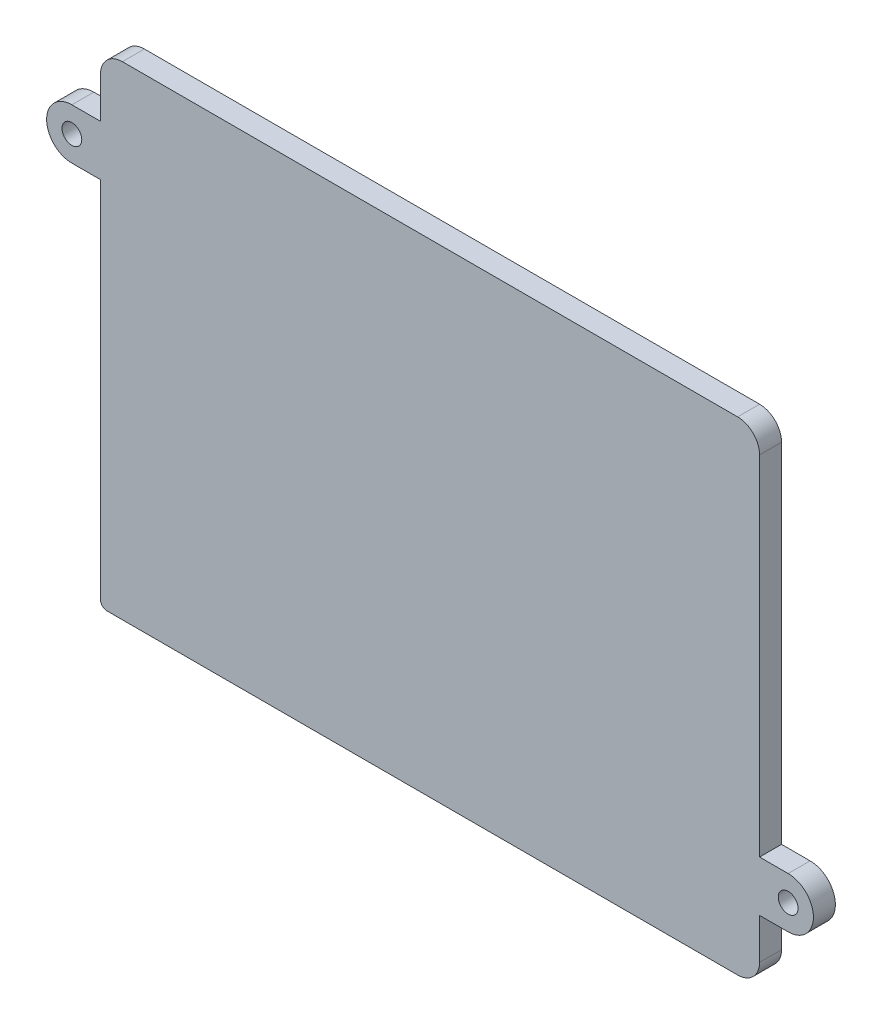
from build123d import *

# Parameters (mm, degrees)
SKETCH1_R           = 2.25
BOSS_EXTRUDE1_DEPTH = 5
BOSS_EXTRUDE2_DEPTH = 2


with BuildPart() as part:
    # Sketch1 → Boss-Extrude1 (new body)
    with BuildSketch(Plane.XY):
        with BuildLine():
            ThreePointArc((75, 50), (73.535533906, 53.535533906), (70, 55))
            Line((70, 55), (-70, 55))
            ThreePointArc((-70, 55), (-73.535533906, 53.535533906), (-75, 50))
            Line((-75, 50), (-75, 40.75))
            Line((-75, 40.75), (-81.5, 40.75))
            ThreePointArc((-81.5, 40.75), (-87.25, 35), (-81.5, 29.25))
            Line((-81.5, 29.25), (-75, 29.25))
            Line((-75, 29.25), (-75, -53.5))
            ThreePointArc((-75, -53.5), (-74.560660172, -54.560660172), (-73.5, -55))
            Line((-73.5, -55), (70, -55))
            ThreePointArc((70, -55), (73.535533906, -53.535533906), (75, -50))
            Line((75, -50), (75, -40.75))
            Line((75, -40.75), (81.5, -40.75))
            ThreePointArc((81.5, -40.75), (87.25, -35), (81.5, -29.25))
            Line((81.5, -29.25), (75, -29.25))
            Line((75, -29.25), (75, 50))
        make_face()
        with Locations((-81.5, 35)):
            Circle(SKETCH1_R, mode=Mode.SUBTRACT)
        with Locations((81.5, -35)):
            Circle(SKETCH1_R, mode=Mode.SUBTRACT)
    extrude(amount=BOSS_EXTRUDE1_DEPTH)

    # Sketch3 → Boss-Extrude2 (add)
    with BuildSketch(Plane.XY):
        with BuildLine():
            ThreePointArc((-65, 48.5), (-67.474873734, 47.474873734), (-68.5, 45))
            Line((-68.5, 45), (-68.5, -45))
            ThreePointArc((-68.5, -45), (-67.474873734, -47.474873734), (-65, -48.5))
            Line((-65, -48.5), (65, -48.5))
            ThreePointArc((65, -48.5), (67.474873734, -47.474873734), (68.5, -45))
            Line((68.5, -45), (68.5, 45))
            ThreePointArc((68.5, 45), (67.474873734, 47.474873734), (65, 48.5))
            Line((65, 48.5), (-65, 48.5))
        make_face()
    extrude(amount=-BOSS_EXTRUDE2_DEPTH)


solid = part.part
